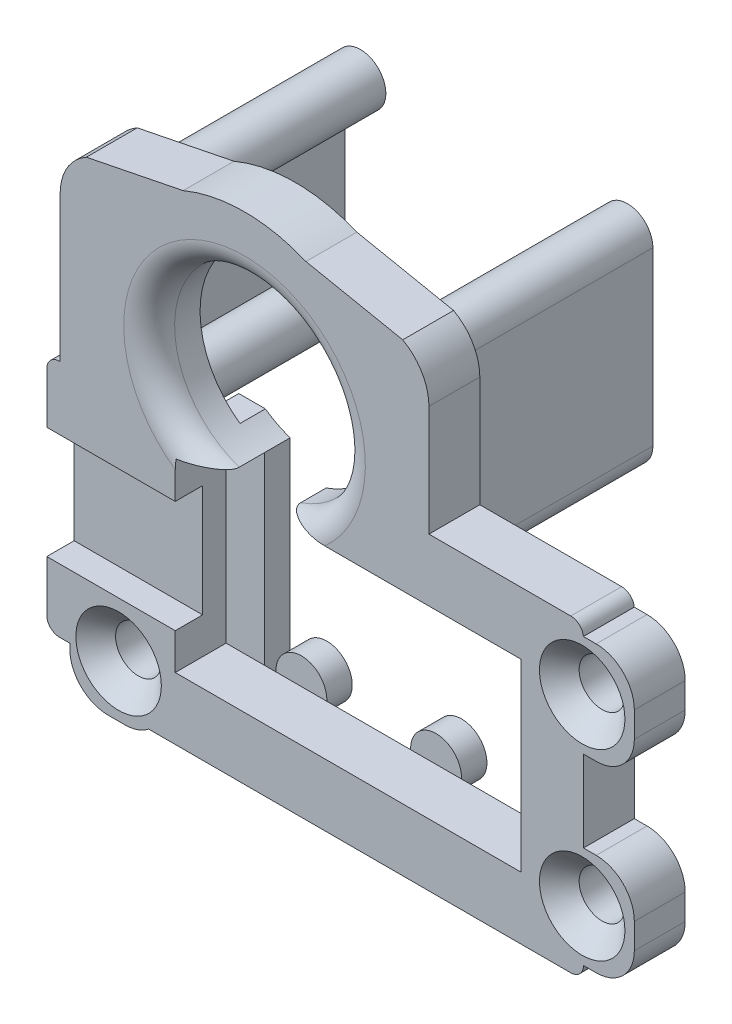
from build123d import *

# Parameters (mm, degrees)
BOSS_EXTRUDE1_DEPTH                                  = 4
SKETCH5_W                                            = 5.2
SKETCH5_H                                            = 8.8
SKETCH5_W_2                                          = 5
CUT_EXTRUDE1_DEPTH                                   = 2.15
FILLET1_R                                            = 1
BOSS_EXTRUDE2_OUTLINE_R                              = 1
BOSS_EXTRUDE2_DEPTH                                  = 15.61
BOSS_EXTRUDE5_START                                  = -5
BOSS_EXTRUDE5_DEPTH                                  = 5
BOSS_EXTRUDE8_DEPTH                                  = 4
FILLET3_R                                            = 2
SKETCH9_R                                            = 2
BOSS_EXTRUDE9_DEPTH                                  = 2
SKETCH10_W                                           = 27.2
SKETCH10_H                                           = 14.5
SKETCH10_W_2                                         = 27
SKETCH10_H_2                                         = 14.3
CUT_EXTRUDE4_DEPTH                                   = 4
BOSS_EXTRUDE10_START                                 = 2
BOSS_EXTRUDE10_DEPTH                                 = 2
SKETCH12_W                                           = 8
SKETCH12_H                                           = 8
SKETCH12_W_2                                         = 6.2
SKETCH12_H_2                                         = 6.2
BOSS_EXTRUDE11_DEPTH                                 = 4
FILLET4_R                                            = 3
FILLET5_R                                            = 3
CSK_FOR_M3_HEX_SOCKET_COUNTERSUNK_CAP_SC_D           = 3.6
CSK_FOR_M3_HEX_SOCKET_COUNTERSUNK_CAP_SC_DEPTH       = 14.44
CSK_FOR_M3_HEX_SOCKET_COUNTERSUNK_CAP_SC_CSINK_D     = 6.72
CSK_FOR_M3_HEX_SOCKET_COUNTERSUNK_CAP_SC_CSINK_ANGLE = 90
CSK_FOR_M3_HEX_SOCKET_COUNTERSUNK_CAP_SC_TIP         = 1.081549114


# Read off the part's stored shape, not the designer's step: Boss-Extrude2
with BuildPart() as part:
    # Sketch3 → Boss-Extrude1 (new body)
    with BuildSketch(Plane.XY):
        with BuildLine():
            Line((5, 19.3), (-9.345122918, 19.3))
            ThreePointArc((-9.345122918, 19.3), (-23.0857932, 33.91726612), (-33.128131381, 16.55))
            Line((-33.128131381, 16.55), (-37.2, 16.55))
            Line((-37.2, 16.55), (-37.2, -2.25))
            Line((-37.2, -2.25), (-32, -2.25))
            Line((-32, -2.25), (-32, -5))
            Line((-32, -5), (5, -5))
            Line((5, -5), (5, 19.3))
        make_face()
        with BuildLine():
            ThreePointArc((-23.75, 14.3), (-25.677557149, 15.173169561), (-27.284491991, 16.55))
            ThreePointArc((-27.284491991, 16.55), (-19.55505766, 28.701473224), (-19.55, 14.3))
            Line((-19.55, 14.3), (0, 14.3))
            Line((0, 14.3), (0, 0))
            Line((0, 0), (-27, 0))
            Line((-27, 0), (-27, 14.3))
            Line((-27, 14.3), (-23.75, 14.3))
        make_face(mode=Mode.SUBTRACT)
    extrude(amount=BOSS_EXTRUDE1_DEPTH)

    # Sketch5 → Cut-Extrude1 (cut)
    with BuildSketch(Plane.XY.offset(4)):
        with Locations((-29.6, 7.15)):
            Rectangle(SKETCH5_W, SKETCH5_H)
        with Locations((-34.7, 7.15)):
            Rectangle(SKETCH5_W_2, SKETCH5_H)
    extrude(amount=-CUT_EXTRUDE1_DEPTH, mode=Mode.SUBTRACT)

    # Fillet1
    fillet1_edges = [part.edges().sort_by_distance(p)[0] for p in [
        (5, 19.3, 2),
        (5, -5, 2),
        (-32, -5, 2),
        (-32, -2.25, 2),
        (-37.2, -2.25, 2),
        (-37.2, 16.55, 2),
    ]]
    fillet(fillet1_edges, radius=FILLET1_R)

    # Boss-Extrude2 outline → Boss-Extrude2 (add)
    # profile 1 of 2: a face of its own
    with BuildSketch(Plane.XY.offset(-15.61)):
        with BuildLine():
            ThreePointArc((-9.15, 28), (-12.938854382, 28.894427191), (-9.95, 26.4))
            Line((-9.95, 26.4), (-9.95, 16.1))
            ThreePointArc((-9.95, 16.1), (-12.938854382, 13.605572809), (-9.15, 14.5))
            Line((-9.15, 14.5), (-9.15, 28))
        make_face()
        with Locations((-11.15, 14.5)):
            Circle(BOSS_EXTRUDE2_OUTLINE_R, mode=Mode.SUBTRACT)
        with Locations((-11.15, 28)):
            Circle(BOSS_EXTRUDE2_OUTLINE_R, mode=Mode.SUBTRACT)
    # profile 2 of 2: a face of its own
    with BuildSketch(Plane.XY.offset(-15.61)):
        with BuildLine():
            ThreePointArc((-33.35, 26.4), (-30.361145618, 28.894427191), (-34.15, 28))
            Line((-34.15, 28), (-34.15, 14.5))
            ThreePointArc((-34.15, 14.5), (-30.361145618, 13.605572809), (-33.35, 16.1))
            Line((-33.35, 16.1), (-33.35, 26.4))
        make_face()
        with Locations((-32.15, 14.5)):
            Circle(BOSS_EXTRUDE2_OUTLINE_R, mode=Mode.SUBTRACT)
        with Locations((-32.15, 28)):
            Circle(BOSS_EXTRUDE2_OUTLINE_R, mode=Mode.SUBTRACT)
    extrude(amount=BOSS_EXTRUDE2_DEPTH)

    # Sketch7 → Boss-Extrude5 (add)
    with BuildSketch(Plane.XY.offset(BOSS_EXTRUDE5_START)):
        with BuildLine():
            Line((-13.139974874, 14.3), (-11.15, 15.313011827))
            Line((-11.15, 15.313011827), (-9.160025126, 14.3))
            ThreePointArc((-9.160025126, 14.3), (-11.15, 12.5), (-13.139974874, 14.3))
        make_face()
    extrude(amount=BOSS_EXTRUDE5_DEPTH)

    # Sketch8 → Boss-Extrude8 (add)
    with BuildSketch(Plane(origin=(0, 0, 0), x_dir=(-1, 0, 0), z_dir=(0, 0, -1))):
        with BuildLine():
            ThreePointArc((12.211302304, 29.695180645), (14.32299851, 31.627440405), (16.818882283, 33.02867302))
            Line((16.818882283, 33.02867302), (9.212271747, 31.499315535))
            ThreePointArc((9.212271747, 31.499315535), (7.703921576, 30.030897214), (7.15, 28))
            Line((7.15, 28), (7.15, 21.5))
            Line((7.15, 21.5), (7.15, 19.3))
            Line((7.15, 19.3), (9.15, 19.3))
            Line((9.15, 19.3), (9.15, 21.5))
            Line((9.15, 21.5), (9.15, 28))
            ThreePointArc((9.15, 28), (10.181135873, 29.749657768), (12.211302304, 29.695180645))
        make_face()
        with BuildLine():
            Line((9.15, 19.3), (9.95, 19.3))
            Line((9.95, 19.3), (9.95, 25.9))
            ThreePointArc((9.95, 25.9), (10.02628451, 26.097742729), (10.105910811, 26.294163617))
            ThreePointArc((10.105910811, 26.294163617), (12.850530293, 26.947290771), (12.211302304, 29.695180645))
            ThreePointArc((12.211302304, 29.695180645), (10.181135873, 29.749657768), (9.15, 28))
            Line((9.15, 28), (9.15, 21.5))
            Line((9.15, 21.5), (9.15, 19.3))
        make_face()
        with BuildLine():
            Line((34.15, 28), (34.15, 21.5))
            Line((34.15, 21.5), (34.15, 16.55))
            Line((34.15, 16.55), (36.15, 16.55))
            Line((36.15, 16.55), (36.15, 21.5))
            Line((36.15, 21.5), (36.15, 28))
            ThreePointArc((36.15, 28), (35.596078424, 30.030897214), (34.087728253, 31.499315535))
            Line((34.087728253, 31.499315535), (26.481117717, 33.02867302))
            ThreePointArc((26.481117717, 33.02867302), (28.97700149, 31.627440405), (31.088697696, 29.695180645))
            ThreePointArc((31.088697696, 29.695180645), (33.118864127, 29.749657768), (34.15, 28))
        make_face()
        with BuildLine():
            Line((33.35, 21.5), (34.15, 21.5))
            Line((34.15, 21.5), (34.15, 28))
            ThreePointArc((34.15, 28), (33.118864127, 29.749657768), (31.088697696, 29.695180645))
            ThreePointArc((31.088697696, 29.695180645), (30.449469707, 26.947290771), (33.194089189, 26.294163617))
            ThreePointArc((33.194089189, 26.294163617), (33.27371549, 26.097742729), (33.35, 25.9))
            Line((33.35, 25.9), (33.35, 21.5))
        make_face()
        with BuildLine():
            Line((34.15, 16.55), (34.15, 21.5))
            Line((34.15, 21.5), (33.35, 21.5))
            Line((33.35, 21.5), (33.35, 17.1))
            ThreePointArc((33.35, 17.1), (33.242328005, 16.82368399), (33.128131381, 16.55))
            Line((33.128131381, 16.55), (33.35, 16.55))
            Line((33.35, 16.55), (33.35, 16.1))
            ThreePointArc((33.35, 16.1), (30.361145618, 13.605572809), (34.15, 14.5))
            Line((34.15, 14.5), (34.15, 16.55))
        make_face()
        with BuildLine():
            Line((29.15, 21.5), (33.35, 21.5))
            Line((33.35, 21.5), (33.35, 25.9))
            ThreePointArc((33.35, 25.9), (33.27371549, 26.097742729), (33.194089189, 26.294163617))
            ThreePointArc((33.194089189, 26.294163617), (30.449469707, 26.947290771), (31.088697696, 29.695180645))
            ThreePointArc((31.088697696, 29.695180645), (28.97700149, 31.627440405), (26.481117717, 33.02867302))
            Line((26.481117717, 33.02867302), (21.65, 34))
            Line((21.65, 34), (16.818882283, 33.02867302))
            ThreePointArc((16.818882283, 33.02867302), (14.32299851, 31.627440405), (12.211302304, 29.695180645))
            ThreePointArc((12.211302304, 29.695180645), (12.850530293, 26.947290771), (10.105910811, 26.294163617))
            ThreePointArc((10.105910811, 26.294163617), (10.02628451, 26.097742729), (9.95, 25.9))
            Line((9.95, 25.9), (9.95, 19.3))
            Line((9.95, 19.3), (14.479923292, 19.3))
            ThreePointArc((14.479923292, 19.3), (20.537699526, 28.917060581), (29.15, 21.5))
        make_face()
    extrude(amount=-BOSS_EXTRUDE8_DEPTH)

    # Fillet3
    fillet3_edges = [part.edges().sort_by_distance(p)[0] for p in [
        (-20.537699526, 28.917060581, 4),
    ]]
    fillet(fillet3_edges, radius=FILLET3_R)

    # Sketch9 → Boss-Extrude9 (add)
    with BuildSketch(Plane(origin=(0, 0, 0), x_dir=(-1, 0, 0), z_dir=(0, 0, -1))):
        with Locations((10.589759588, 0)):
            Circle(SKETCH9_R)
        with Locations((21.179764077, 0)):
            Circle(SKETCH9_R)
    extrude(amount=BOSS_EXTRUDE9_DEPTH)

    # Sketch10 → Cut-Extrude4 (cut)
    with BuildSketch(Plane.XY.offset(4)):
        with Locations((-13.5, 7.15)):
            Rectangle(SKETCH10_W, SKETCH10_H)
        with Locations((-13.5, 7.15)):
            Rectangle(SKETCH10_W_2, SKETCH10_H_2, mode=Mode.SUBTRACT)
    extrude(amount=-CUT_EXTRUDE4_DEPTH, mode=Mode.SUBTRACT)

    # Sketch11 → Boss-Extrude10 (add)
    with BuildSketch(Plane(origin=(0, 0, 0), x_dir=(-1, 0, 0), z_dir=(0, 0, -1)).offset(BOSS_EXTRUDE10_START)):
        with BuildLine():
            Line((24.066609195, -0.1), (24.066609195, 14.4))
            ThreePointArc((24.066609195, 14.4), (25.07672129, 14.828599757), (26.013484846, 15.4))
            Line((26.013484846, 15.4), (28.1, 15.4))
            Line((28.1, 15.4), (28.1, -0.1))
            Line((28.1, -0.1), (28.1, -1.1))
            Line((28.1, -1.1), (24.066609195, -1.1))
            Line((24.066609195, -1.1), (24.066609195, -0.1))
        make_face()
    extrude(amount=-BOSS_EXTRUDE10_DEPTH)

    # Sketch12 → Boss-Extrude11 (add)
    with BuildSketch(Plane.XY.offset(4)):
        with Locations((5, 0)):
            Rectangle(SKETCH12_W, SKETCH12_H)
        with Locations((5, 14.4)):
            Rectangle(SKETCH12_W, SKETCH12_H)
        with Locations((-32.292893219, -2.542893219)):
            Rectangle(SKETCH12_W_2, SKETCH12_H_2)
    extrude(amount=-BOSS_EXTRUDE11_DEPTH)

    # Fillet4
    fillet4_edges = [part.edges().sort_by_distance(p)[0] for p in [
        (9, 4, 2),
        (9, -4, 2),
        (9, 10.4, 2),
        (9, 18.4, 2),
        (-35.392893219, -5.642893219, 2),
    ]]
    fillet(fillet4_edges, radius=FILLET4_R)

    # Fillet5
    # the kernel refuses this fillet: 3 mm, written as the material it takes off along each edge
    with BuildSketch(Plane(origin=(-29.192893219, -5.642893219, 8.63953636), x_dir=(-1, 0, 0), z_dir=(0, 0, -1))) as fillet5_piece_1:
        with BuildLine():
            CenterArc((1.855814544, 3), FILLET5_R, 231.785675488, 38.214324512)
            Line((0, 0.642893219), (-0.037116291, 0.595751083))
            ThreePointArc((-0.037116291, 0.595751083), (-0.06, 0.321446609), (-0.06, 0))
            Line((-0.06, 0), (0, -0.06))
            Line((0, -0.06), (1.855814544, -0.06))
            Line((1.855814544, -0.06), (1.855814544, 0))
        make_face()
    extrude(amount=13.27907272, mode=Mode.SUBTRACT)

    # CSK for M3 Hex Socket Countersunk Cap Screw1
    with Locations(Plane.XY.offset(4)):
        with Locations((4.900331387, 0), (4.900331387, 14.4), (-31.553809286, -1.547116477)):
            CounterSinkHole(CSK_FOR_M3_HEX_SOCKET_COUNTERSUNK_CAP_SC_D / 2, CSK_FOR_M3_HEX_SOCKET_COUNTERSUNK_CAP_SC_CSINK_D / 2, depth=CSK_FOR_M3_HEX_SOCKET_COUNTERSUNK_CAP_SC_DEPTH, counter_sink_angle=CSK_FOR_M3_HEX_SOCKET_COUNTERSUNK_CAP_SC_CSINK_ANGLE)
            with Locations((0, 0, -(CSK_FOR_M3_HEX_SOCKET_COUNTERSUNK_CAP_SC_DEPTH + CSK_FOR_M3_HEX_SOCKET_COUNTERSUNK_CAP_SC_TIP / 2))):  # 118° drill point
                Cone(0, CSK_FOR_M3_HEX_SOCKET_COUNTERSUNK_CAP_SC_D / 2, CSK_FOR_M3_HEX_SOCKET_COUNTERSUNK_CAP_SC_TIP, mode=Mode.SUBTRACT)


solid = part.part
